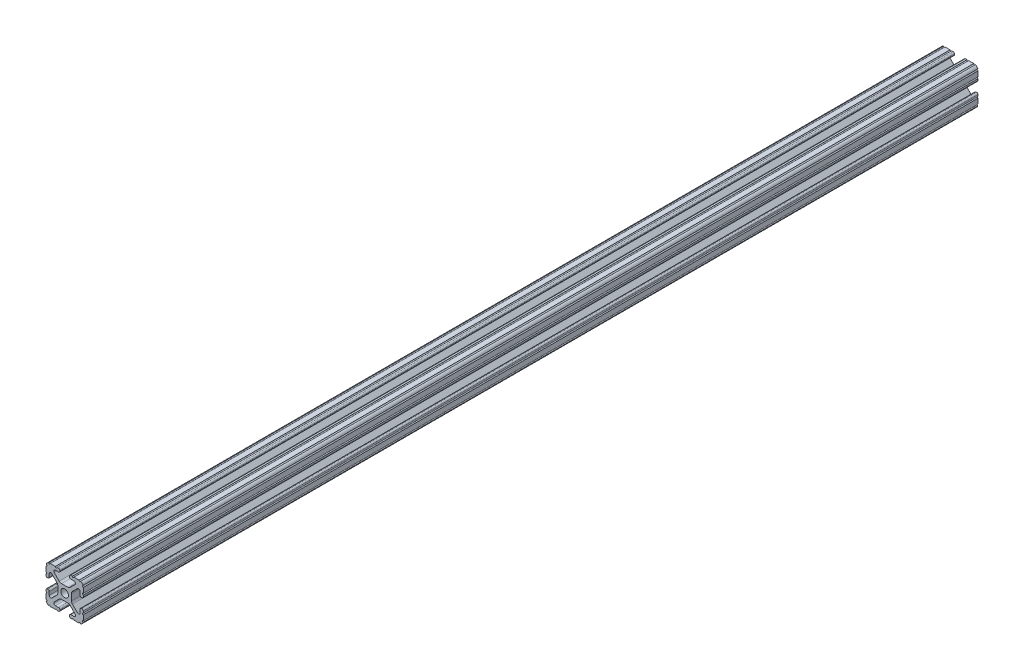
from build123d import *

# Parameters (mm, degrees)
BOSS_EXTRUDE1_DEPTH     = 304.8
CUT_EXTRUDE1_DEPTH      = 306.328708116
CUT_EXTRUDE1_DEPTH_BACK = 306.328708116
SKETCH5_R               = 0.55245
CUT_EXTRUDE2_DEPTH      = 31.496
CUT_EXTRUDE2_DEPTH_BACK = 71.628
SKETCH6_R               = 2.6035


with BuildPart() as part:
    # Sketch4 → Boss-Extrude1 (new, symmetric)
    with BuildSketch(Plane.XY):
        with BuildLine():
            Line((4.190365, -12.7), (10.11729625, -12.7))
            ThreePointArc((10.11729625, -12.7), (11.943543585, -11.943543585), (12.7, -10.11729625))
            Line((12.7, -10.11729625), (12.7, -4.190365))
            ThreePointArc((12.7, -4.190365), (12.42492494, -3.52627506), (11.760835, -3.2512))
            Line((11.760835, -3.2512), (11.429365, -3.2512))
            ThreePointArc((11.429365, -3.2512), (10.76527506, -3.52627506), (10.4902, -4.190365))
            Line((10.4902, -4.190365), (10.4902, -6.348478019))
            ThreePointArc((10.4902, -6.348478019), (9.830707141, -7.335478831), (8.666460301, -7.103895736))
            Line((8.666460301, -7.103895736), (5.299899128, -3.737334563))
            ThreePointArc((5.299899128, -3.737334563), (4.817571085, -3.015479634), (4.6482, -2.16399369))
            Line((4.6482, -2.16399369), (4.6482, 0))
            Line((4.6482, 0), (2.6035, 0))
            ThreePointArc((2.6035, 0), (1.840952505, -1.840952505), (0, -2.6035))
            Line((0, -2.6035), (0, -4.6482))
            Line((0, -4.6482), (2.16399369, -4.6482))
            ThreePointArc((2.16399369, -4.6482), (3.015479634, -4.817571085), (3.737334563, -5.299899128))
            Line((3.737334563, -5.299899128), (7.103895736, -8.666460301))
            ThreePointArc((7.103895736, -8.666460301), (7.335478831, -9.830707141), (6.348478019, -10.4902))
            Line((6.348478019, -10.4902), (4.190365, -10.4902))
            ThreePointArc((4.190365, -10.4902), (3.52627506, -10.76527506), (3.2512, -11.429365))
            Line((3.2512, -11.429365), (3.2512, -11.760835))
            ThreePointArc((3.2512, -11.760835), (3.52627506, -12.42492494), (4.190365, -12.7))
        make_face()
    extrude(amount=BOSS_EXTRUDE1_DEPTH, both=True)

    # Sketch5 → Cut-Extrude1 (cut, two sides: drawn at the far end of the back side and taken through both)
    with BuildSketch(Plane.XY.offset(-CUT_EXTRUDE1_DEPTH_BACK)):
        with Locations((10.356153152, -12.7)):
            Circle(SKETCH5_R)
        with Locations((5.796028019, -12.7)):
            Circle(SKETCH5_R)
        with Locations((12.7, -10.356153152)):
            Circle(SKETCH5_R)
        with Locations((12.7, -5.796028019)):
            Circle(SKETCH5_R)
    extrude(amount=CUT_EXTRUDE1_DEPTH + CUT_EXTRUDE1_DEPTH_BACK, mode=Mode.SUBTRACT)

    # Mirror1: part across plane


with BuildPart() as part_1:
    add(part.part)
    add(part.part.mirror(Plane(origin=(0, 0, 0), x_dir=(0, 0, 1), z_dir=(1, 0, 0))))

    # Mirror2: part across plane


with BuildPart() as part_2:
    add(part_1.part)
    add(part_1.part.mirror(Plane.ZX))

    # Sketch6 → Cut-Extrude2 (cut, two sides: drawn at the far end of the back side and taken through both)
    with BuildSketch(Plane(origin=(0, 4.6482, 0), x_dir=(1, 0, 0), z_dir=(0, 1, 0)).offset(-CUT_EXTRUDE2_DEPTH_BACK)):
        with Locations((0, 254)):
            Circle(SKETCH6_R)
        with Locations((0, 177.8)):
            Circle(SKETCH6_R)
        with Locations((0, -152.4)):
            Circle(SKETCH6_R)
    extrude(amount=CUT_EXTRUDE2_DEPTH + CUT_EXTRUDE2_DEPTH_BACK, mode=Mode.SUBTRACT)


solid = part_2.part
